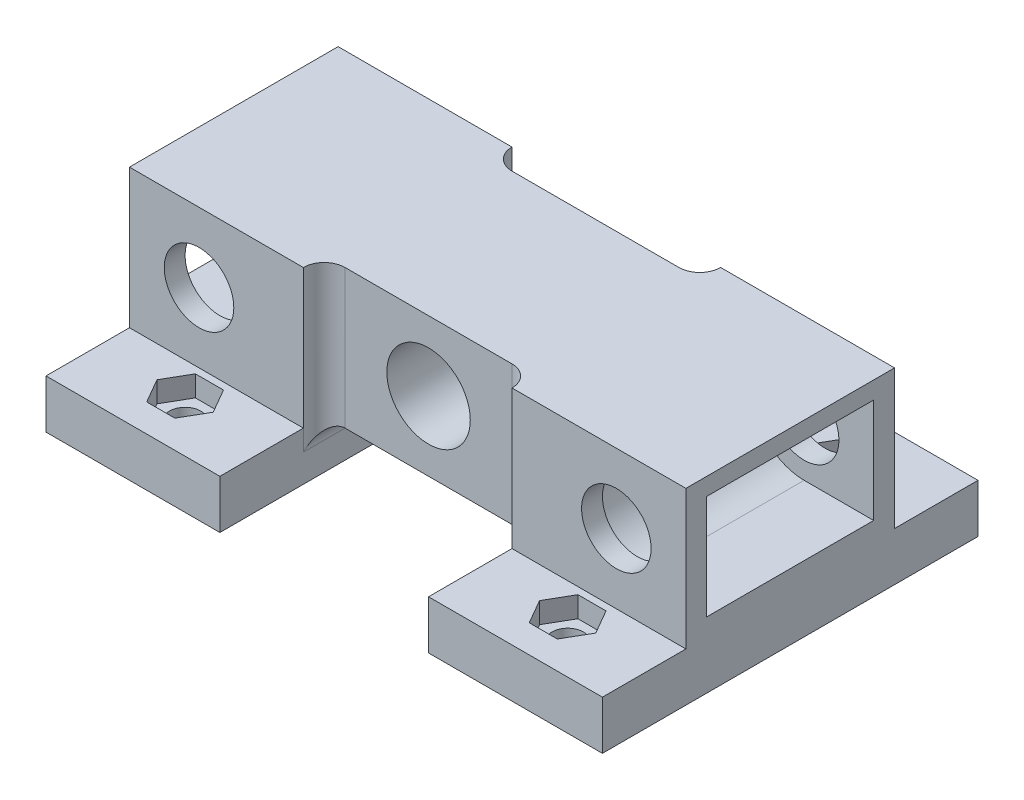
from build123d import *

# Parameters (mm, degrees)
BOSS_EXTRUDE1_DEPTH      = 12
BOSS_EXTRUDE1_DEPTH_BACK = 12
SKETCH1_W                = 80
SKETCH1_H                = 20
SKETCH1_R                = 6
SKETCH1_R_2              = 7.5
SKETCH2_W                = 25
SKETCH2_H                = 54
BOSS_EXTRUDE2_DEPTH      = 7
CUT_EXTRUDE1_DEPTH       = 3
MIRROR2_COPY_1_DEPTH     = 3
D_GAGEMENT_M41_D         = 4.5
CUT_EXTRUDE2_DEPTH       = 59.395205283
SKETCH7_W                = 25
SKETCH7_H                = 20
BOSS_EXTRUDE3_DEPTH      = 3
SKETCH8_W                = 25
SKETCH8_H                = 20
BOSS_EXTRUDE4_DEPTH      = 3
CUT_EXTRUDE3_DEPTH       = 59.395205283
CUT_EXTRUDE3_DEPTH_BACK  = 59.395205283
SKETCH10_R               = 5
FILLET1_R                = 3


with BuildPart() as part:
    # Sketch1 → Boss-Extrude1 (new, two sides: drawn at the far end of the back side and taken through both)
    with BuildSketch(Plane.XY.offset(-BOSS_EXTRUDE1_DEPTH_BACK)):
        Rectangle(SKETCH1_W, SKETCH1_H)
        Circle(SKETCH1_R, mode=Mode.SUBTRACT)
        with Locations((30, 0)):
            Circle(SKETCH1_R_2, mode=Mode.SUBTRACT)
        with Locations((-30, 0)):
            Circle(SKETCH1_R_2, mode=Mode.SUBTRACT)
    extrude(amount=BOSS_EXTRUDE1_DEPTH + BOSS_EXTRUDE1_DEPTH_BACK)

    # Sketch2 → Boss-Extrude2 (add)
    with BuildSketch(Plane.XZ.offset(10)):
        with Locations((27.5, 0)):
            Rectangle(SKETCH2_W, SKETCH2_H)
        with Locations((-27.5, 0)):
            Rectangle(SKETCH2_W, SKETCH2_H)
    extrude(amount=BOSS_EXTRUDE2_DEPTH)

    # Sketch3 → Cut-Extrude1 (cut)
    with BuildSketch(Plane(origin=(0, -10, 0), x_dir=(1, 0, 0), z_dir=(0, 1, 0))):
        Polygon((29.520725942, 23.000000033), (25.479274058, 23.000000033), (23.458548116, 19.500000033), (25.479274058, 16.000000033), (29.520725942, 16.000000033), (31.541451884, 19.500000033), align=None)
    cut_extrude1 = extrude(amount=-CUT_EXTRUDE1_DEPTH, mode=Mode.SUBTRACT)

    # Mirror1: Cut-Extrude1 across plane
    add(cut_extrude1.mirror(Plane(origin=(0, 0, 0), x_dir=(0, 0, 1), z_dir=(1, 0, 0))), mode=Mode.SUBTRACT)

    # Mirror2: Cut-Extrude1 across plane
    add(cut_extrude1.mirror(Plane.XY), mode=Mode.SUBTRACT)

    # Mirror2 copy 1 sketch → Mirror2 copy 1 (cut)
    with BuildSketch(Plane(origin=(0, -10, 0), x_dir=(-1, 0, 0), z_dir=(0, 1, 0))):
        Polygon((29.520725942, 23.000000033), (25.479274058, 23.000000033), (23.458548116, 19.500000033), (25.479274058, 16.000000033), (29.520725942, 16.000000033), (31.541451884, 19.500000033), align=None)
    extrude(amount=-MIRROR2_COPY_1_DEPTH, mode=Mode.SUBTRACT)

    # Dégagement M41 (through all)
    with Locations(Plane(origin=(0, -13, 0), x_dir=(1, 0, 0), z_dir=(0, 1, 0))):
        with Locations((27.5, 19.5), (27.5, -19.5), (-27.5, -19.5), (-27.5, 19.5)):
            Hole(D_GAGEMENT_M41_D / 2)

    # Sketch6 → Cut-Extrude2 (cut, through all)
    with BuildSketch(Plane(origin=(0, 0, -12), x_dir=(-1, 0, 0), z_dir=(0, 0, -1))):
        with BuildLine():
            Line((-30, 7.5), (-40, 7.5))
            Line((-40, 7.5), (-40, -7.5))
            Line((-40, -7.5), (-30, -7.5))
            ThreePointArc((-30, -7.5), (-37.5, 0), (-30, 7.5))
        make_face()
    cut_extrude2 = extrude(amount=-CUT_EXTRUDE2_DEPTH, mode=Mode.SUBTRACT)

    # Mirror3: Cut-Extrude2 across plane
    add(cut_extrude2.mirror(Plane(origin=(0, 0, 0), x_dir=(0, 0, 1), z_dir=(1, 0, 0))), mode=Mode.SUBTRACT)

    # Sketch7 → Boss-Extrude3 (add)
    with BuildSketch(Plane(origin=(0, 0, -12), x_dir=(-1, 0, 0), z_dir=(0, 0, -1))):
        with Locations((-27.5, 0)):
            Rectangle(SKETCH7_W, SKETCH7_H)
        with Locations((27.5, 0)):
            Rectangle(SKETCH7_W, SKETCH7_H)
    extrude(amount=BOSS_EXTRUDE3_DEPTH)

    # Sketch8 → Boss-Extrude4 (add)
    with BuildSketch(Plane.XY.offset(12)):
        with Locations((27.5, 0)):
            Rectangle(SKETCH8_W, SKETCH8_H)
        with Locations((-27.5, 0)):
            Rectangle(SKETCH8_W, SKETCH8_H)
    extrude(amount=BOSS_EXTRUDE4_DEPTH)

    # Sketch10 → Cut-Extrude3 (cut, two sides: drawn at the far end of the back side and taken through both)
    with BuildSketch(Plane.XY.offset(-12).offset(-CUT_EXTRUDE3_DEPTH_BACK)):
        with Locations((30, 0)):
            Circle(SKETCH10_R)
        with Locations((-30, 0)):
            Circle(SKETCH10_R)
    extrude(amount=CUT_EXTRUDE3_DEPTH + CUT_EXTRUDE3_DEPTH_BACK, mode=Mode.SUBTRACT)

    # Fillet1
    fillet1_edges = [part.edges().sort_by_distance(p)[0] for p in [
        (15, -10, 0),
        (-15, -10, 0),
        (-15, 0, -12),
        (15, 0, -12),
        (-15, 0, 12),
        (15, 0, 12),
    ]]
    fillet(fillet1_edges, radius=FILLET1_R - 0.0001)  # a hair under: the kernel refuses the full size


solid = part.part
